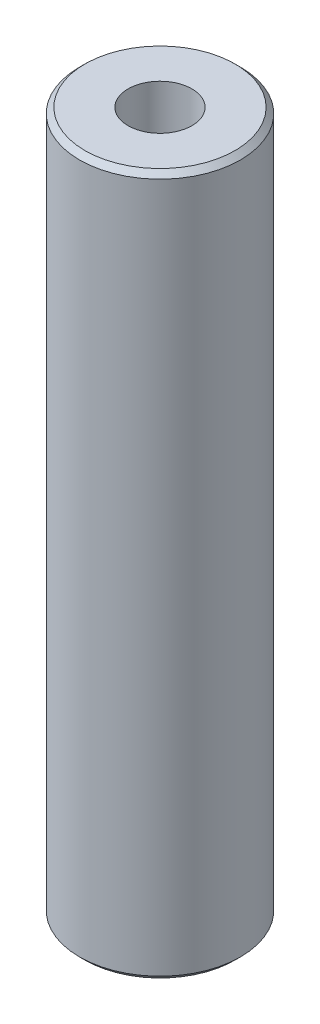
from build123d import *

# Parameters (mm, degrees)
SKETCH1_R           = 60
BOSS_EXTRUDE1_DEPTH = 522.785871985
SKETCH2_R           = 23.812352151
CUT_EXTRUDE1_DEPTH  = 530.627291543
CHAMFER1_SIZE       = 4.030771509


with BuildPart() as part:
    # Sketch1 → Boss-Extrude1 (new body)
    with BuildSketch(Plane(origin=(0, 0, 0), x_dir=(1, 0, 0), z_dir=(0, 1, 0))):
        Circle(SKETCH1_R)
    extrude(amount=BOSS_EXTRUDE1_DEPTH)

    # Sketch2 → Cut-Extrude1 (cut, through all)
    with BuildSketch(Plane(origin=(0, 0, 0), x_dir=(1, 0, 0), z_dir=(0, 1, 0))):
        Circle(SKETCH2_R)
    extrude(amount=CUT_EXTRUDE1_DEPTH, mode=Mode.SUBTRACT)

    # Chamfer1
    chamfer1_edges = [part.edges().sort_by_distance(p)[0] for p in [
        (-60, 522.785871985, 0),
        (-60, 0, 0),
    ]]
    chamfer(chamfer1_edges, length=CHAMFER1_SIZE)


solid = part.part
